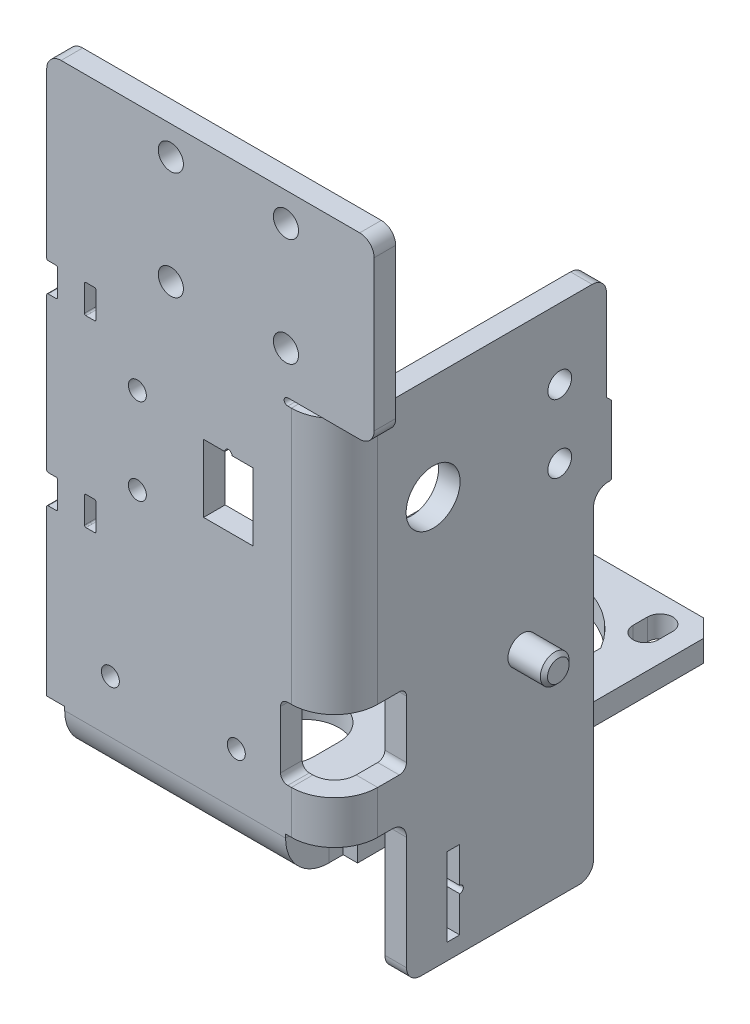
from build123d import *

# Parameters (mm, degrees)
BRIDA_START                        = -3
BRIDA_BASE1_OUTLINE_R              = 1
BRIDA_BASE1_OUTLINE_R_2            = 1.75
BRIDA_BASE1_DEPTH                  = 3
STEPPER_IDLER_EDGE_STRIP_W         = 18
STEPPER_IDLER_EDGE_STRIP_H         = 3
STEPPER_IDLER_EDGE_STRIP_CUT_DEPTH = 35.2
STEPPER_IDLER_EDGE_DEPTH           = 35.2
DESDOBLAR5_DEPTH                   = 35.2
DESDOBLAR5_2_DEPTH                 = 35.2
CORTAR_EXTRUIR13_DEPTH             = 10
CORTAR_EXTRUIR14_DEPTH             = 10
DOBLAR10_DEPTH                     = 35.2
DOBLAR10_START                     = 2.5
DOBLAR10_2_DEPTH                   = 30.7
DOBLAR10_3_OUTLINE_W               = 3
DOBLAR10_3_OUTLINE_H               = 48.55
DOBLAR10_3_DEPTH                   = 35.2
DOBLAR10_START_2                   = 33.2
DOBLAR10_4_OUTLINE_W               = 3
DOBLAR10_4_OUTLINE_H               = 2
DOBLAR10_4_DEPTH                   = 2
STEPPER_MOUNT_REACH                = 111.815
IDLER_REACH                        = 111.815
RAIL_REACH                         = 114.046
CROQUIS12_W                        = 6.9
CROQUIS12_H                        = 9.4
M3_TAPPED_HOLE1_D                  = 2.5
M3_TAPPED_HOLE1_DEPTH              = 8.5
M3_TAPPED_HOLE1_TIP                = 0.751075774
BRIDA_START_2                      = -50.75
BRIDA_DE_ARISTA1_OUTLINE_W         = 3
BRIDA_DE_ARISTA1_OUTLINE_H         = 1.8
BRIDA_DE_ARISTA1_DEPTH             = 24.9
BRIDA_DE_ARISTA1_2_OUTLINE_W       = 3
BRIDA_DE_ARISTA1_2_OUTLINE_H       = 0.7
BRIDA_DE_ARISTA1_2_DEPTH           = 9.6
BRIDA_START_3                      = -77.5
BRIDA_DE_ARISTA1_3_DEPTH           = 52.65
BRIDA_DE_ARISTA1_4_DEPTH           = 51.65
BRIDA_START_4                      = -6
BRIDA_DE_ARISTA1_5_DEPTH           = 7
CORTAR_EXTRUIR4_REACH              = 111.928
CROQUIS30_R                        = 1.65
CROQUIS31_W                        = 26
CROQUIS31_H                        = 19.7
PESTA_A1_DEPTH                     = 3
DESDOBLAR3_START                   = -38.5
DESDOBLAR3_DEPTH                   = 35.5
DESDOBLAR3_START_2                 = -3
DESDOBLAR3_2_OUTLINE_R             = 1.65
DESDOBLAR3_2_DEPTH                 = 3
CORTAR_EXTRUIR6_REACH              = 137.234
CROQUIS38_W                        = 12.568583471
CROQUIS38_H                        = 10
REDONDEO6_R                        = 1
DOBLAR3_START                      = -97.2
DOBLAR3_DEPTH                      = 71.35
DOBLAR3_2_OUTLINE_W                = 3
DOBLAR3_2_OUTLINE_H                = 26
DOBLAR3_2_DEPTH                    = 71.35
DOBLAR3_START_2                    = -62.5
DOBLAR3_3_DEPTH                    = 36.65
DOBLAR3_START_3                    = -77.5
DOBLAR3_4_DEPTH                    = 7
DOBLAR3_START_4                    = -50.75
DOBLAR3_5_OUTLINE_W                = 3
DOBLAR3_5_OUTLINE_H                = 1.8
DOBLAR3_5_DEPTH                    = 24.9
DOBLAR3_6_OUTLINE_W                = 3
DOBLAR3_6_OUTLINE_H                = 0.7
DOBLAR3_6_DEPTH                    = 9.6
DOBLAR3_START_5                    = 33
DOBLAR3_7_OUTLINE_R                = 1.65
DOBLAR3_7_DEPTH                    = 8
CORTAR_EXTRUIR8_REACH              = 122.847
CROQUIS40_W                        = 1.6
CROQUIS40_H                        = 4
CROQUIS40_W_2                      = 1.5
REDONDEO12_R                       = 0.2
REDONDEO5_R                        = 2
CORTAR_EXTRUIR9_REACH              = 122.316
CROQUIS41_R                        = 3.75
CHAFL_N1_SIZE                      = 2.5
REDONDEO7_R                        = 0.25
CORTAR_EXTRUIR10_REACH             = 122.316
CROQUIS42_R                        = 0.5
CROQUIS42_W                        = 1.8
CROQUIS42_H                        = 10.9
CORTAR_EXTRUIR11_REACH             = 122.316
CROQUIS49_R                        = 2
S_LIDO_MOVER_COPIAR10_ANGLE        = 90
REDONDEO9_START                    = 36
REDONDEO9_DEPTH                    = 5
REDONDEO9_START_2                  = 37
REDONDEO9_2_DEPTH                  = 3


with BuildPart() as part:
    # Brida base1: read off the stored shape, not the designer's step
    # Brida base1 outline → Brida base1 (new body)
    with BuildSketch(Plane.XY.offset(BRIDA_START)):
        Polygon((45.5, -24.85), (45.5, 0), (0, 0), (0, -84), (35.2, -84), (35.2, -24.85), align=None)
        with Locations((8.85, -70.7)):
            Circle(BRIDA_BASE1_OUTLINE_R, mode=Mode.SUBTRACT)
        with Locations((26.35, -70.7)):
            Circle(BRIDA_BASE1_OUTLINE_R, mode=Mode.SUBTRACT)
        with Locations((17.25, -19)):
            Circle(BRIDA_BASE1_OUTLINE_R_2, mode=Mode.SUBTRACT)
        with Locations((17.25, -4)):
            Circle(BRIDA_BASE1_OUTLINE_R_2, mode=Mode.SUBTRACT)
        with Locations((33.25, -19)):
            Circle(BRIDA_BASE1_OUTLINE_R_2, mode=Mode.SUBTRACT)
        with Locations((33.25, -4)):
            Circle(BRIDA_BASE1_OUTLINE_R_2, mode=Mode.SUBTRACT)
    extrude(amount=BRIDA_BASE1_DEPTH)

    # Stepper Idler Edge: sheet metal written as solids
    # Stepper Idler Edge strip (on a plane across the edge) → Stepper Idler Edge strip cut (cut)
    with BuildSketch(Plane(origin=(35.2, -84, -3), x_dir=(0, 1, 0), z_dir=(-1, 0, 0))):
        with Locations((-3, -1.5)):
            Rectangle(STEPPER_IDLER_EDGE_STRIP_W, STEPPER_IDLER_EDGE_STRIP_H)
    extrude(amount=STEPPER_IDLER_EDGE_STRIP_CUT_DEPTH, mode=Mode.SUBTRACT)

    # Stepper Idler Edge section (on a plane across the edge) → Stepper Idler Edge (add)
    with BuildSketch(Plane(origin=(35.2, -84, -3), x_dir=(0, 1, 0), z_dir=(-1, 0, 0))):
        with BuildLine():
            Line((0, 3), (0, 55.55))
            Line((0, 55.55), (3, 55.55))
            Line((3, 55.55), (3, 3))
            ThreePointArc((3, 3), (3.878679656, 0.878679656), (6, 0))
            Line((6, 0), (6, -3))
            ThreePointArc((6, -3), (1.757359313, -1.242640687), (0, 3))
        make_face()
    extrude(amount=STEPPER_IDLER_EDGE_DEPTH)

    # Desdoblar5: read off the stored shape, not the designer's step
    # Desdoblar5 outline → Desdoblar5 (cut)
    with BuildSketch(Plane.YZ):
        with BuildLine():
            Line((-78, -3), (-83.196152423, -3))
            ThreePointArc((-83.196152423, -3), (-83.795554958, -4.447085729), (-84, -6))
            Line((-84, -6), (-84, -58.55))
            Line((-84, -58.55), (-81, -58.55))
            Line((-81, -58.55), (-81, -6))
            ThreePointArc((-81, -6), (-80.121320344, -3.878679656), (-78, -3))
        make_face()
    extrude(amount=DESDOBLAR5_DEPTH, mode=Mode.SUBTRACT)

    # Desdoblar5 2 outline → Desdoblar5 2 (add)
    with BuildSketch(Plane.YZ):
        with BuildLine():
            Line((-78, 0), (-137.618583471, 0))
            Line((-137.618583471, 0), (-137.618583471, -3))
            Line((-137.618583471, -3), (-83.196152423, -3))
            ThreePointArc((-83.196152423, -3), (-81, -0.803847577), (-78, 0))
        make_face()
    extrude(amount=DESDOBLAR5_2_DEPTH)

    # Croquis67 → Cortar-Extruir13 (cut)
    with BuildSketch(Plane(origin=(0, 0, -3), x_dir=(-1, 0, 0), z_dir=(0, 0, -1))):
        Polygon((-35.2, -77.5), (-33.2, -77.5), (-33.2, -78), (-33.2, -81.534291735), (-33.2, -85.068583471), (-33.2, -87.068583471), (-35.2, -87.068583471), align=None)
    extrude(amount=-CORTAR_EXTRUIR13_DEPTH, mode=Mode.SUBTRACT)

    # Croquis69 → Cortar-Extruir14 (cut)
    with BuildSketch(Plane(origin=(0, 0, -3), x_dir=(-1, 0, 0), z_dir=(0, 0, -1))):
        Polygon((-2.5, -89.068583471), (-2.5, -85.068583471), (-2.5, -81.534291735), (-2.5, -78), (-2.5, -77.5), (0, -77.5), (0, -89.068583471), align=None)
    extrude(amount=-CORTAR_EXTRUIR14_DEPTH, mode=Mode.SUBTRACT)

    # Doblar10: read off the stored shape, not the designer's step
    # Doblar10 outline → Doblar10 (cut)
    with BuildSketch(Plane.YZ):
        with BuildLine():
            ThreePointArc((-83.196152423, -3), (-81, -0.803847577), (-78, 0))
            Line((-78, 0), (-137.618583471, 0))
            Line((-137.618583471, 0), (-137.618583471, -3))
            Line((-137.618583471, -3), (-83.196152423, -3))
        make_face()
    extrude(amount=DOBLAR10_DEPTH, mode=Mode.SUBTRACT)

    # Doblar10 2 outline → Doblar10 2 (add)
    with BuildSketch(Plane.YZ.offset(DOBLAR10_START)):
        with BuildLine():
            ThreePointArc((-83.196152423, -3), (-83.795554958, -4.447085729), (-84, -6))
            Line((-84, -6), (-84, -58.55))
            Line((-84, -58.55), (-81, -58.55))
            Line((-81, -58.55), (-81, -6))
            ThreePointArc((-81, -6), (-80.121320344, -3.878679656), (-78, -3))
            Line((-78, -3), (-83.196152423, -3))
        make_face()
    extrude(amount=DOBLAR10_2_DEPTH)

    # Doblar10 3 outline → Doblar10 3 (add)
    with BuildSketch(Plane.YZ):
        with Locations((-82.5, -34.275)):
            Rectangle(DOBLAR10_3_OUTLINE_W, DOBLAR10_3_OUTLINE_H)
    extrude(amount=DOBLAR10_3_DEPTH)

    # Doblar10 4 outline → Doblar10 4 (add)
    with BuildSketch(Plane.YZ.offset(DOBLAR10_START_2)):
        with Locations((-82.5, -9)):
            Rectangle(DOBLAR10_4_OUTLINE_W, DOBLAR10_4_OUTLINE_H)
    extrude(amount=DOBLAR10_4_DEPTH)

    # Croquis9 → Stepper Mount (cut, up to next)
    with BuildSketch(Plane(origin=(0, -81, 0), x_dir=(1, 0, 0), z_dir=(0, 1, 0)), mode=Mode.PRIVATE) as stepper_mount_sk1:
        with BuildLine():
            Line((28.725, 27.025), (28.725, 29.025))
            ThreePointArc((28.725, 29.025), (30.475, 30.775), (32.225, 29.025))
            Line((32.225, 29.025), (32.225, 27.025))
            ThreePointArc((32.225, 27.025), (30.475, 25.275), (28.725, 27.025))
        make_face()
    stepper_mount_tool1 = extrude(stepper_mount_sk1.sketch, amount=-STEPPER_MOUNT_REACH, mode=Mode.PRIVATE) & part.part
    # Croquis9 → Stepper Mount (cut, up to next)
    with BuildSketch(Plane(origin=(0, -81, 0), x_dir=(1, 0, 0), z_dir=(0, 1, 0)), mode=Mode.PRIVATE) as stepper_mount_sk2:
        with BuildLine():
            Line((2.975, 27.025), (2.975, 29.025))
            ThreePointArc((2.975, 29.025), (4.725, 30.775), (6.475, 29.025))
            Line((6.475, 29.025), (6.475, 27.025))
            ThreePointArc((6.475, 27.025), (4.725, 25.275), (2.975, 27.025))
        make_face()
    stepper_mount_tool2 = extrude(stepper_mount_sk2.sketch, amount=-STEPPER_MOUNT_REACH, mode=Mode.PRIVATE) & part.part
    # Croquis9 → Stepper Mount (cut, up to next)
    with BuildSketch(Plane(origin=(0, -81, 0), x_dir=(1, 0, 0), z_dir=(0, 1, 0)), mode=Mode.PRIVATE) as stepper_mount_sk3:
        with BuildLine():
            Line((2.975, 52.775), (2.975, 54.775))
            ThreePointArc((2.975, 54.775), (4.725, 56.525), (6.475, 54.775))
            Line((6.475, 54.775), (6.475, 52.775))
            ThreePointArc((6.475, 52.775), (4.725, 51.025), (2.975, 52.775))
        make_face()
    stepper_mount_tool3 = extrude(stepper_mount_sk3.sketch, amount=-STEPPER_MOUNT_REACH, mode=Mode.PRIVATE) & part.part
    # Croquis9 → Stepper Mount (cut, up to next)
    with BuildSketch(Plane(origin=(0, -81, 0), x_dir=(1, 0, 0), z_dir=(0, 1, 0)), mode=Mode.PRIVATE) as stepper_mount_sk4:
        with BuildLine():
            Line((28.725, 52.775), (28.725, 54.775))
            ThreePointArc((28.725, 54.775), (30.475, 56.525), (32.225, 54.775))
            Line((32.225, 54.775), (32.225, 52.775))
            ThreePointArc((32.225, 52.775), (30.475, 51.025), (28.725, 52.775))
        make_face()
    stepper_mount_tool4 = extrude(stepper_mount_sk4.sketch, amount=-STEPPER_MOUNT_REACH, mode=Mode.PRIVATE) & part.part
    # Croquis9 → Stepper Mount (cut, up to next)
    with BuildSketch(Plane(origin=(0, -81, 0), x_dir=(1, 0, 0), z_dir=(0, 1, 0)), mode=Mode.PRIVATE) as stepper_mount_sk5:
        with BuildLine():
            Line((29.225, 34.036373043), (29.225, 47.763626957))
            ThreePointArc((29.225, 47.763626957), (17.6, 54.4), (5.975, 47.763626957))
            Line((5.975, 47.763626957), (5.975, 34.036373043))
            ThreePointArc((5.975, 34.036373043), (17.6, 27.4), (29.225, 34.036373043))
        make_face()
    stepper_mount_tool5 = extrude(stepper_mount_sk5.sketch, amount=-STEPPER_MOUNT_REACH, mode=Mode.PRIVATE) & part.part
    add(stepper_mount_tool1.solids().sort_by_distance((30.475, -81, -28.025))[0], mode=Mode.SUBTRACT)
    add(stepper_mount_tool2.solids().sort_by_distance((4.725, -81, -28.025))[0], mode=Mode.SUBTRACT)
    add(stepper_mount_tool3.solids().sort_by_distance((4.725, -81, -53.775))[0], mode=Mode.SUBTRACT)
    add(stepper_mount_tool4.solids().sort_by_distance((30.475, -81, -53.775))[0], mode=Mode.SUBTRACT)
    add(stepper_mount_tool5.solids().sort_by_distance((17.6, -81, -40.9))[0], mode=Mode.SUBTRACT)

    # Idler 2 → Idler (cut, up to next)
    with BuildSketch(Plane(origin=(0, -81, 0), x_dir=(1, 0, 0), z_dir=(0, 1, 0)), mode=Mode.PRIVATE) as idler_sk1:
        with BuildLine():
            Line((22.35, 18.25), (22.35, 14.75))
            ThreePointArc((22.35, 14.75), (17.6, 10), (12.85, 14.75))
            Line((12.85, 14.75), (12.85, 18.25))
            ThreePointArc((12.85, 18.25), (17.6, 23), (22.35, 18.25))
        make_face()
    idler_tool1 = extrude(idler_sk1.sketch, amount=-IDLER_REACH, mode=Mode.PRIVATE) & part.part
    # Idler 2 → Idler (cut, up to next)
    with BuildSketch(Plane(origin=(0, -81, 0), x_dir=(1, 0, 0), z_dir=(0, 1, 0)), mode=Mode.PRIVATE) as idler_sk2:
        with BuildLine():
            Line((30.95, 17), (30.95, 14))
            ThreePointArc((30.95, 14), (29.35, 12.4), (27.75, 14))
            Line((27.75, 14), (27.75, 17))
            ThreePointArc((27.75, 17), (29.35, 18.6), (30.95, 17))
        make_face()
    idler_tool2 = extrude(idler_sk2.sketch, amount=-IDLER_REACH, mode=Mode.PRIVATE) & part.part
    # Idler 2 → Idler (cut, up to next)
    with BuildSketch(Plane(origin=(0, -81, 0), x_dir=(1, 0, 0), z_dir=(0, 1, 0)), mode=Mode.PRIVATE) as idler_sk3:
        with BuildLine():
            Line((4.25, 17.25), (4.25, 13.75))
            ThreePointArc((4.25, 13.75), (5.85, 12.15), (7.45, 13.75))
            Line((7.45, 13.75), (7.45, 17.25))
            ThreePointArc((7.45, 17.25), (5.85, 18.85), (4.25, 17.25))
        make_face()
    idler_tool3 = extrude(idler_sk3.sketch, amount=-IDLER_REACH, mode=Mode.PRIVATE) & part.part
    add(idler_tool1.solids().sort_by_distance((17.6, -81, -16.5))[0], mode=Mode.SUBTRACT)
    add(idler_tool2.solids().sort_by_distance((29.35, -81, -15.5))[0], mode=Mode.SUBTRACT)
    add(idler_tool3.solids().sort_by_distance((5.85, -81, -15.5))[0], mode=Mode.SUBTRACT)

    # Croquis12 → Rail (cut, up to next)
    with BuildSketch(Plane.XY, mode=Mode.PRIVATE) as rail_sk1:
        with Locations((25.25, -40.4)):
            Rectangle(CROQUIS12_W, CROQUIS12_H)
    rail_tool1 = extrude(rail_sk1.sketch, amount=-RAIL_REACH, mode=Mode.PRIVATE) & part.part
    # Croquis12 → Rail (cut, up to next)
    with BuildSketch(Plane.XY, mode=Mode.PRIVATE) as rail_sk2:
        with BuildLine():
            ThreePointArc((25.75, -35.7), (25.25, -35.2), (24.75, -35.7))
            Line((24.75, -35.7), (25.75, -35.7))
        make_face()
    rail_tool2 = extrude(rail_sk2.sketch, amount=-RAIL_REACH, mode=Mode.PRIVATE) & part.part
    add(rail_tool1.solids().sort_by_distance((25.25, -40.4, 0))[0], mode=Mode.SUBTRACT)
    add(rail_tool2.solids().sort_by_distance((25.25, -35.487793, 0))[0], mode=Mode.SUBTRACT)

    # M3 Tapped Hole1
    with Locations(Plane(origin=(12.6, -34.4, 0), x_dir=(1, 0, 0), z_dir=(0, 0, 1))):
        with Locations((0, 0), (0, -12), (-3.75, -36.3), (13.75, -36.3)):
            Hole(M3_TAPPED_HOLE1_D / 2, depth=M3_TAPPED_HOLE1_DEPTH)
            with Locations((0, 0, -(M3_TAPPED_HOLE1_DEPTH + M3_TAPPED_HOLE1_TIP / 2))):  # 118° drill point
                Cone(0, M3_TAPPED_HOLE1_D / 2, M3_TAPPED_HOLE1_TIP, mode=Mode.SUBTRACT)

    # Brida de arista1 3 outline → Brida de arista1 3 (cut)
    with BuildSketch(Plane(origin=(0, 0, 0), x_dir=(1, 0, 0), z_dir=(0, 1, 0)).offset(BRIDA_START_3)):
        with BuildLine():
            Line((35.2, 0), (35.2, 0.121224617))
            ThreePointArc((35.2, 0.121224617), (34.603053772, 0.030383082), (34, 0))
            Line((34, 0), (35.2, 0))
        make_face()
    extrude(amount=BRIDA_DE_ARISTA1_3_DEPTH, mode=Mode.SUBTRACT)



with BuildPart() as body_2:
    # Brida de arista1: read off the stored shape, not the designer's step
    # Brida de arista1 outline → Brida de arista1 (new body)
    with BuildSketch(Plane(origin=(0, 0, 0), x_dir=(1, 0, 0), z_dir=(0, 1, 0)).offset(BRIDA_START_2)):
        with Locations((38.5, 36.9)):
            Rectangle(BRIDA_DE_ARISTA1_OUTLINE_W, BRIDA_DE_ARISTA1_OUTLINE_H)
    extrude(amount=BRIDA_DE_ARISTA1_DEPTH)

    # Brida de arista1 2 outline → Brida de arista1 2 (add)
    with BuildSketch(Plane(origin=(0, 0, 0), x_dir=(1, 0, 0), z_dir=(0, 1, 0)).offset(BRIDA_START_2)):
        with Locations((38.5, 38.15)):
            Rectangle(BRIDA_DE_ARISTA1_2_OUTLINE_W, BRIDA_DE_ARISTA1_2_OUTLINE_H)
    extrude(amount=BRIDA_DE_ARISTA1_2_DEPTH)


with BuildPart() as part_1:
    add(part.part)

    add(body_2.part)  # Brida de arista1 4 merges body 2
    # Brida de arista1 4 outline → Brida de arista1 4 (add)
    with BuildSketch(Plane(origin=(0, 0, 0), x_dir=(1, 0, 0), z_dir=(0, 1, 0)).offset(BRIDA_START_3)):
        with BuildLine():
            Line((40, 6), (40, 36))
            Line((40, 36), (37, 36))
            Line((37, 36), (37, 6))
            ThreePointArc((37, 6), (36.121320344, 3.878679656), (34, 3))
            Line((34, 3), (35.2, 3))
            Line((35.2, 3), (35.2, 0.121224617))
            ThreePointArc((35.2, 0.121224617), (38.647580015, 2.205266808), (40, 6))
        make_face()
    extrude(amount=BRIDA_DE_ARISTA1_4_DEPTH)

    # Brida de arista1 5 outline → Brida de arista1 5 (cut)
    with BuildSketch(Plane.XY.offset(BRIDA_START_4)):
        with BuildLine():
            Line((35.2, -24.85), (33.5, -24.85))
            ThreePointArc((33.5, -24.85), (33, -25.35), (33.5, -25.85))
            Line((33.5, -25.85), (35.2, -25.85))
            Line((35.2, -25.85), (35.2, -24.85))
        make_face()
    extrude(amount=BRIDA_DE_ARISTA1_5_DEPTH, mode=Mode.SUBTRACT)

    # Croquis30 → Cortar-Extruir4 (cut, up to next)
    with BuildSketch(Plane(origin=(40, 0, 0), x_dir=(0, 0, -1), z_dir=(1, 0, 0)), mode=Mode.PRIVATE) as cortar_extruir4_sk1:
        with Locations((31.3, -35.65)):
            Circle(CROQUIS30_R)
    cortar_extruir4_tool1 = extrude(cortar_extruir4_sk1.sketch, amount=-CORTAR_EXTRUIR4_REACH, mode=Mode.PRIVATE) & part_1.part
    # Croquis30 → Cortar-Extruir4 (cut, up to next)
    with BuildSketch(Plane(origin=(40, 0, 0), x_dir=(0, 0, -1), z_dir=(1, 0, 0)), mode=Mode.PRIVATE) as cortar_extruir4_sk2:
        with Locations((31.3, -45.15)):
            Circle(CROQUIS30_R)
    cortar_extruir4_tool2 = extrude(cortar_extruir4_sk2.sketch, amount=-CORTAR_EXTRUIR4_REACH, mode=Mode.PRIVATE) & part_1.part
    add(cortar_extruir4_tool1.solids().sort_by_distance((40, -35.65, -31.3))[0], mode=Mode.SUBTRACT)
    add(cortar_extruir4_tool2.solids().sort_by_distance((40, -45.15, -31.3))[0], mode=Mode.SUBTRACT)

    # Pestaña1: sheet metal written as solids
    # Croquis31 → Pestaña1 (add)
    with BuildSketch(Plane(origin=(40, 0, 0), x_dir=(0, 0, -1), z_dir=(1, 0, 0))):
        with Locations((23, -87.35)):
            Rectangle(CROQUIS31_W, CROQUIS31_H)
    extrude(amount=-PESTA_A1_DEPTH)

    # Desdoblar3: read off the stored shape, not the designer's step
    # Desdoblar3 outline → Desdoblar3 (cut)
    with BuildSketch(Plane.XY.offset(DESDOBLAR3_START)):
        Polygon((40, -25.85), (34, -25.85), (34, -77.5), (37, -77.5), (37, -97.2), (40, -97.2), align=None)
    extrude(amount=DESDOBLAR3_DEPTH, mode=Mode.SUBTRACT)

    # Desdoblar3 2 outline → Desdoblar3 2 (add)
    with BuildSketch(Plane.XY.offset(DESDOBLAR3_START_2)):
        Polygon((72.868583471, -25.85), (34, -25.85), (34, -77.5), (45.068583471, -77.5), (45.068583471, -97.2), (71.068583471, -97.2), (71.068583471, -50.75), (73.568583471, -50.75), (73.568583471, -41.15), (72.868583471, -41.15), align=None)
        with Locations((66.368583471, -45.15)):
            Circle(DESDOBLAR3_2_OUTLINE_R, mode=Mode.SUBTRACT)
        with Locations((66.368583471, -35.65)):
            Circle(DESDOBLAR3_2_OUTLINE_R, mode=Mode.SUBTRACT)
    extrude(amount=DESDOBLAR3_2_DEPTH)

    # Croquis38 → Cortar-Extruir6 (cut, up to next)
    with BuildSketch(Plane.XY, mode=Mode.PRIVATE) as cortar_extruir6_sk1:
        with Locations((38.784291736, -66.5)):
            Rectangle(CROQUIS38_W, CROQUIS38_H)
    cortar_extruir6_tool1 = extrude(cortar_extruir6_sk1.sketch, amount=-CORTAR_EXTRUIR6_REACH, mode=Mode.PRIVATE) & part_1.part
    add(cortar_extruir6_tool1.solids().sort_by_distance((38.784292, -66.5, 0))[0], mode=Mode.SUBTRACT)

    # Redondeo6
    redondeo6_edges = [part_1.edges().sort_by_distance(p)[0] for p in [
        (32.5, -71.5, -1.5),
        (32.5, -61.5, -1.5),
        (45.068583471, -61.5, -1.5),
        (45.068583471, -71.5, -1.5),
    ]]
    fillet(redondeo6_edges, radius=REDONDEO6_R)

    # Doblar3: read off the stored shape, not the designer's step
    # Doblar3 outline → Doblar3 (cut)
    with BuildSketch(Plane(origin=(0, 0, 0), x_dir=(1, 0, 0), z_dir=(0, 1, 0)).offset(DOBLAR3_START)):
        with BuildLine():
            ThreePointArc((39.196152423, 3), (37, 0.803847577), (34, 0))
            Line((34, 0), (73.568583471, 0))
            Line((73.568583471, 0), (73.568583471, 3))
            Line((73.568583471, 3), (39.196152423, 3))
        make_face()
    extrude(amount=DOBLAR3_DEPTH, mode=Mode.SUBTRACT)



with BuildPart() as body_2_2:
    # Doblar3 2 outline → Doblar3 2 (new body)
    with BuildSketch(Plane(origin=(0, 0, 0), x_dir=(1, 0, 0), z_dir=(0, 1, 0)).offset(DOBLAR3_START)):
        with Locations((38.5, 23)):
            Rectangle(DOBLAR3_2_OUTLINE_W, DOBLAR3_2_OUTLINE_H)
    extrude(amount=DOBLAR3_2_DEPTH)


with BuildPart() as part_2:
    add(part_1.part)

    add(body_2_2.part)  # Doblar3 3 merges body 2 2
    # Doblar3 3 outline → Doblar3 3 (add)
    with BuildSketch(Plane(origin=(0, 0, 0), x_dir=(1, 0, 0), z_dir=(0, 1, 0)).offset(DOBLAR3_START_2)):
        with BuildLine():
            Line((40, 10), (37, 10))
            Line((37, 10), (37, 6))
            ThreePointArc((37, 6), (36.121320344, 3.878679656), (34, 3))
            Line((34, 3), (39.196152423, 3))
            ThreePointArc((39.196152423, 3), (39.795554958, 4.447085729), (40, 6))
            Line((40, 6), (40, 10))
        make_face()
    extrude(amount=DOBLAR3_3_DEPTH)

    # Doblar3 4 outline → Doblar3 4 (add)
    with BuildSketch(Plane(origin=(0, 0, 0), x_dir=(1, 0, 0), z_dir=(0, 1, 0)).offset(DOBLAR3_START_3)):
        with BuildLine():
            Line((40, 10), (37, 10))
            Line((37, 10), (37, 6))
            ThreePointArc((37, 6), (36.121320344, 3.878679656), (34, 3))
            Line((34, 3), (39.196152423, 3))
            ThreePointArc((39.196152423, 3), (39.795554958, 4.447085729), (40, 6))
            Line((40, 6), (40, 10))
        make_face()
    extrude(amount=DOBLAR3_4_DEPTH)

    # Doblar3 5 outline → Doblar3 5 (add)
    with BuildSketch(Plane(origin=(0, 0, 0), x_dir=(1, 0, 0), z_dir=(0, 1, 0)).offset(DOBLAR3_START_4)):
        with Locations((38.5, 36.9)):
            Rectangle(DOBLAR3_5_OUTLINE_W, DOBLAR3_5_OUTLINE_H)
    extrude(amount=DOBLAR3_5_DEPTH)

    # Doblar3 6 outline → Doblar3 6 (add)
    with BuildSketch(Plane(origin=(0, 0, 0), x_dir=(1, 0, 0), z_dir=(0, 1, 0)).offset(DOBLAR3_START_4)):
        with Locations((38.5, 38.15)):
            Rectangle(DOBLAR3_6_OUTLINE_W, DOBLAR3_6_OUTLINE_H)
    extrude(amount=DOBLAR3_6_DEPTH)

    # Doblar3 7 outline → Doblar3 7 (cut)
    with BuildSketch(Plane.YZ.offset(DOBLAR3_START_5)):
        with BuildLine():
            Line((-61.5, -9), (-61.5, -3))
            Line((-61.5, -3), (-62.5, -3))
            Line((-62.5, -3), (-62.5, -10))
            ThreePointArc((-62.5, -10), (-61.792893219, -9.707106781), (-61.5, -9))
        make_face()
        with BuildLine():
            Line((-70.5, -3), (-71.5, -3))
            Line((-71.5, -3), (-71.5, -9))
            ThreePointArc((-71.5, -9), (-71.207106781, -9.707106781), (-70.5, -10))
            Line((-70.5, -10), (-70.5, -3))
        make_face()
        with Locations((-35.65, -31.3)):
            Circle(DOBLAR3_7_OUTLINE_R)
        with Locations((-45.15, -31.3)):
            Circle(DOBLAR3_7_OUTLINE_R)
    extrude(amount=DOBLAR3_7_DEPTH, mode=Mode.SUBTRACT)

    # Croquis40 → Cortar-Extruir8 (cut, up to next)
    with BuildSketch(Plane(origin=(0, 0, -3), x_dir=(-1, 0, 0), z_dir=(0, 0, -1)), mode=Mode.PRIVATE) as cortar_extruir8_sk1:
        with Locations((-6.05, -27)):
            Rectangle(CROQUIS40_W, CROQUIS40_H)
    cortar_extruir8_tool1 = extrude(cortar_extruir8_sk1.sketch, amount=-CORTAR_EXTRUIR8_REACH, mode=Mode.PRIVATE) & part_2.part
    # Croquis40 → Cortar-Extruir8 (cut, up to next)
    with BuildSketch(Plane(origin=(0, 0, -3), x_dir=(-1, 0, 0), z_dir=(0, 0, -1)), mode=Mode.PRIVATE) as cortar_extruir8_sk2:
        with Locations((-0.75, -27)):
            Rectangle(CROQUIS40_W_2, CROQUIS40_H)
    cortar_extruir8_tool2 = extrude(cortar_extruir8_sk2.sketch, amount=-CORTAR_EXTRUIR8_REACH, mode=Mode.PRIVATE) & part_2.part
    # Croquis40 → Cortar-Extruir8 (cut, up to next)
    with BuildSketch(Plane(origin=(0, 0, -3), x_dir=(-1, 0, 0), z_dir=(0, 0, -1)), mode=Mode.PRIVATE) as cortar_extruir8_sk3:
        with Locations((-6.05, -52.5)):
            Rectangle(CROQUIS40_W, CROQUIS40_H)
    cortar_extruir8_tool3 = extrude(cortar_extruir8_sk3.sketch, amount=-CORTAR_EXTRUIR8_REACH, mode=Mode.PRIVATE) & part_2.part
    # Croquis40 → Cortar-Extruir8 (cut, up to next)
    with BuildSketch(Plane(origin=(0, 0, -3), x_dir=(-1, 0, 0), z_dir=(0, 0, -1)), mode=Mode.PRIVATE) as cortar_extruir8_sk4:
        with Locations((-0.75, -52.5)):
            Rectangle(CROQUIS40_W_2, CROQUIS40_H)
    cortar_extruir8_tool4 = extrude(cortar_extruir8_sk4.sketch, amount=-CORTAR_EXTRUIR8_REACH, mode=Mode.PRIVATE) & part_2.part
    add(cortar_extruir8_tool1.solids().sort_by_distance((6.05, -27, -3))[0], mode=Mode.SUBTRACT)
    add(cortar_extruir8_tool2.solids().sort_by_distance((0.75, -27, -3))[0], mode=Mode.SUBTRACT)
    add(cortar_extruir8_tool3.solids().sort_by_distance((6.05, -52.5, -3))[0], mode=Mode.SUBTRACT)
    add(cortar_extruir8_tool4.solids().sort_by_distance((0.75, -52.5, -3))[0], mode=Mode.SUBTRACT)

    # Redondeo12
    redondeo12_edges = [part_2.edges().sort_by_distance(p)[0] for p in [
        (6.85, -29, -1.5),
        (6.85, -25, -1.5),
        (5.25, -25, -1.5),
        (5.25, -29, -1.5),
        (1.5, -29, -1.5),
        (1.5, -25, -1.5),
        (0, -25, -1.5),
        (0, -29, -1.5),
        (6.85, -54.5, -1.5),
        (6.85, -50.5, -1.5),
        (5.25, -50.5, -1.5),
        (5.25, -54.5, -1.5),
        (1.5, -54.5, -1.5),
        (1.5, -50.5, -1.5),
        (0, -50.5, -1.5),
        (0, -54.5, -1.5),
    ]]
    fillet(redondeo12_edges, radius=REDONDEO12_R)

    # Redondeo5
    redondeo5_edges = [part_2.edges().sort_by_distance(p)[0] for p in [
        (45.5, -24.85, -1.5),
        (45.5, 0, -1.5),
        (0, 0, -1.5),
        (38.5, -97.2, -10),
        (38.5, -97.2, -36),
        (38.5, -50.75, -36),
        (38.5, -77.5, -10),
        (38.5, -25.85, -37.8),
    ]]
    fillet(redondeo5_edges, radius=REDONDEO5_R)

    # Croquis41 → Cortar-Extruir9 (cut, up to next)
    with BuildSketch(Plane(origin=(40, 0, 0), x_dir=(0, 0, -1), z_dir=(1, 0, 0)), mode=Mode.PRIVATE) as cortar_extruir9_sk1:
        with Locations((13.7, -40.4)):
            Circle(CROQUIS41_R)
    cortar_extruir9_tool1 = extrude(cortar_extruir9_sk1.sketch, amount=-CORTAR_EXTRUIR9_REACH, mode=Mode.PRIVATE) & part_2.part
    add(cortar_extruir9_tool1.solids().sort_by_distance((40, -40.4, -13.7))[0], mode=Mode.SUBTRACT)

    # Chaflán1
    chafl_n1_edges = [part_2.edges().sort_by_distance(p)[0] for p in [
        (35.2, -82.5, -58.55),
        (0, -82.5, -58.55),
    ]]
    chamfer(chafl_n1_edges, length=CHAFL_N1_SIZE)

    # Redondeo7
    redondeo7_edges = [part_2.edges().sort_by_distance(p)[0] for p in [
        (38.5, -50.75, -38.5),
    ]]
    fillet(redondeo7_edges, radius=REDONDEO7_R)

    # Croquis42 → Cortar-Extruir10 (cut, up to next)
    with BuildSketch(Plane(origin=(40, 0, 0), x_dir=(0, 0, -1), z_dir=(1, 0, 0)), mode=Mode.PRIVATE) as cortar_extruir10_sk1:
        with Locations((17.4, -89.5)):
            Circle(CROQUIS42_R)
    cortar_extruir10_tool1 = extrude(cortar_extruir10_sk1.sketch, amount=-CORTAR_EXTRUIR10_REACH, mode=Mode.PRIVATE) & part_2.part
    # Croquis42 → Cortar-Extruir10 (cut, up to next)
    with BuildSketch(Plane(origin=(40, 0, 0), x_dir=(0, 0, -1), z_dir=(1, 0, 0)), mode=Mode.PRIVATE) as cortar_extruir10_sk2:
        with Locations((16.5, -89.5)):
            Rectangle(CROQUIS42_W, CROQUIS42_H)
    cortar_extruir10_tool2 = extrude(cortar_extruir10_sk2.sketch, amount=-CORTAR_EXTRUIR10_REACH, mode=Mode.PRIVATE) & part_2.part
    # Croquis42 → Cortar-Extruir10 (cut, up to next)
    with BuildSketch(Plane(origin=(40, 0, 0), x_dir=(0, 0, -1), z_dir=(1, 0, 0)), mode=Mode.PRIVATE) as cortar_extruir10_sk3:
        with BuildLine():
            ThreePointArc((17.9, -89.5), (17.753553391, -89.146446609), (17.4, -89))
            Line((17.4, -89), (17.4, -90))
            ThreePointArc((17.4, -90), (17.753553391, -89.853553391), (17.9, -89.5))
        make_face()
    cortar_extruir10_tool3 = extrude(cortar_extruir10_sk3.sketch, amount=-CORTAR_EXTRUIR10_REACH, mode=Mode.PRIVATE) & part_2.part
    # Croquis42 → Cortar-Extruir10 (cut, up to next)
    with BuildSketch(Plane(origin=(40, 0, 0), x_dir=(0, 0, -1), z_dir=(1, 0, 0)), mode=Mode.PRIVATE) as cortar_extruir10_sk4:
        with BuildLine():
            Line((17.4, -90), (17.4, -89))
            ThreePointArc((17.4, -89), (16.9, -89.5), (17.4, -90))
        make_face()
    cortar_extruir10_tool4 = extrude(cortar_extruir10_sk4.sketch, amount=-CORTAR_EXTRUIR10_REACH, mode=Mode.PRIVATE) & part_2.part
    # Croquis42 → Cortar-Extruir10 (cut, up to next)
    with BuildSketch(Plane(origin=(40, 0, 0), x_dir=(0, 0, -1), z_dir=(1, 0, 0)), mode=Mode.PRIVATE) as cortar_extruir10_sk5:
        with BuildLine():
            ThreePointArc((17.9, -89.5), (17.753553391, -89.146446609), (17.4, -89))
            Line((17.4, -89), (17.4, -90))
            ThreePointArc((17.4, -90), (17.753553391, -89.853553391), (17.9, -89.5))
        make_face()
    cortar_extruir10_tool5 = extrude(cortar_extruir10_sk5.sketch, amount=-CORTAR_EXTRUIR10_REACH, mode=Mode.PRIVATE) & part_2.part
    # Croquis42 → Cortar-Extruir10 (cut, up to next)
    with BuildSketch(Plane(origin=(40, 0, 0), x_dir=(0, 0, -1), z_dir=(1, 0, 0)), mode=Mode.PRIVATE) as cortar_extruir10_sk6:
        with BuildLine():
            Line((17.4, -90), (17.4, -89))
            ThreePointArc((17.4, -89), (16.9, -89.5), (17.4, -90))
        make_face()
    cortar_extruir10_tool6 = extrude(cortar_extruir10_sk6.sketch, amount=-CORTAR_EXTRUIR10_REACH, mode=Mode.PRIVATE) & part_2.part
    add(cortar_extruir10_tool1.solids().sort_by_distance((40, -89.5, -17.4))[0], mode=Mode.SUBTRACT)
    add(cortar_extruir10_tool2.solids().sort_by_distance((40, -89.5, -16.5))[0], mode=Mode.SUBTRACT)
    add(cortar_extruir10_tool3.solids().sort_by_distance((40, -89.5, -17.612207))[0], mode=Mode.SUBTRACT)
    add(cortar_extruir10_tool4.solids().sort_by_distance((40, -89.5, -17.187793))[0], mode=Mode.SUBTRACT)
    add(cortar_extruir10_tool5.solids().sort_by_distance((40, -89.5, -17.612207))[0], mode=Mode.SUBTRACT)
    add(cortar_extruir10_tool6.solids().sort_by_distance((40, -89.5, -17.187793))[0], mode=Mode.SUBTRACT)

    # Croquis49 → Cortar-Extruir11 (cut, up to next)
    with BuildSketch(Plane(origin=(40, 0, 0), x_dir=(0, 0, -1), z_dir=(1, 0, 0)), mode=Mode.PRIVATE) as cortar_extruir11_sk1:
        with Locations((26.1, -65)):
            Circle(CROQUIS49_R)
    cortar_extruir11_tool1 = extrude(cortar_extruir11_sk1.sketch, amount=-CORTAR_EXTRUIR11_REACH, mode=Mode.PRIVATE) & part_2.part
    add(cortar_extruir11_tool1.solids().sort_by_distance((40, -65, -26.1))[0], mode=Mode.SUBTRACT)

    # Redondeo9: read off the stored shape, not the designer's step
    # Redondeo9 outline → Redondeo9 (cut)
    with BuildSketch(Plane.YZ.offset(REDONDEO9_START)):
        with BuildLine():
            Line((-41.15, -38.5), (-41.15, -38.47754493))
            ThreePointArc((-41.15, -38.47754493), (-41.20057336, -38.494321747), (-41.253553391, -38.5))
            Line((-41.253553391, -38.5), (-41.15, -38.5))
        make_face()
    extrude(amount=REDONDEO9_DEPTH, mode=Mode.SUBTRACT)

    # Redondeo9 2 outline → Redondeo9 2 (add)
    with BuildSketch(Plane.YZ.offset(REDONDEO9_START_2)):
        with BuildLine():
            ThreePointArc((-41.15, -38.47754493), (-41.111108339, -38.455449281), (-41.076776695, -38.426776695))
            Line((-41.076776695, -38.426776695), (-40.523223305, -37.873223305))
            ThreePointArc((-40.523223305, -37.873223305), (-40.442117467, -37.819030117), (-40.346446609, -37.8))
            Line((-40.346446609, -37.8), (-41.15, -37.8))
            Line((-41.15, -37.8), (-41.15, -38.47754493))
        make_face()
    extrude(amount=REDONDEO9_2_DEPTH)


with BuildPart() as body_2_3:
    # FH-M4-8: read off the stored shape, not the designer's step
    # FH-M4-8 outline → FH-M4-8 (revolve)
    with BuildSketch(Plane(origin=(89.506702416, 0, -45.870892863), x_dir=(1, 0, 0), z_dir=(0, 0, 1))):
        Polygon((0, -38.115111025), (0, -46.115111025), (1.5, -46.115111025), (2, -45.615111025), (2, -40.515111025), (2.95, -40.515111025), (2.95, -38.115111025), align=None)
    revolve(axis=Axis((89.506702416, 0, -45.870892863), (0, 1, 0)))


with BuildPart() as body_2_3_1:
    # Sólido-Mover/Copiar10: read off the stored shape, not the designer's step
    # Sólido-Mover/Copiar10: moved
    add(body_2_3.part.moved(Location((-154.5067024, 1.115111, 19.7708929))).rotate(Axis((0, 0, 0), (0, 0, 1)), S_LIDO_MOVER_COPIAR10_ANGLE))


solid = Compound([part_2.part, body_2_3_1.part])
